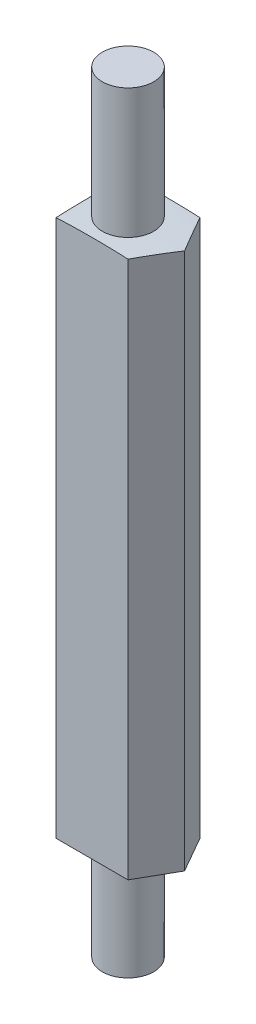
from build123d import *

# Parameters (mm, degrees)
CORPS_D_PLACER_COPIER2_DEPTH = 104.8
BOSS_EXTRU_1_DEPTH           = 20
BOSS_EXTRU_1_DEPTH_BACK      = 130
ESQUISSE1_R                  = 5


with BuildPart() as part:
    # Corps-Déplacer/Copier2: read off the stored shape, not the designer's step
    # Corps-Déplacer/Copier2 outline → Corps-Déplacer/Copier2 (new body)
    with BuildSketch(Plane(origin=(0, 0, 0), x_dir=(1, 0, 0), z_dir=(0, 1, 0))):
        Polygon((7, 7), (-7, 7), (-7, -7), (7, -7), (11, 0), align=None)
    extrude(amount=CORPS_D_PLACER_COPIER2_DEPTH)

    # Corps-D_placer_Copier2 2 outline → Corps-D_placer_Copier2 2 (revolve, cut)
    with BuildSketch(Plane.XY):
        with BuildLine():
            Line((11, 104.8), (5, 104.8))
            ThreePointArc((5, 104.8), (8.003766504, 104.724764387), (11, 104.499246226))
            Line((11, 104.499246226), (11, 104.8))
        make_face()
    revolve(axis=Axis((0, 0, 0), (0, 1, 0)), mode=Mode.SUBTRACT)

    # Esquisse1 → Boss.-Extru.1 (add, two sides: drawn at the far end of the back side and taken through both)
    with BuildSketch(Plane.XZ.offset(-BOSS_EXTRU_1_DEPTH_BACK)):
        with Locations(Location((0, 0, 0), (0, 0, 270))):
            Circle(ESQUISSE1_R)
    extrude(amount=BOSS_EXTRU_1_DEPTH + BOSS_EXTRU_1_DEPTH_BACK)


solid = part.part
